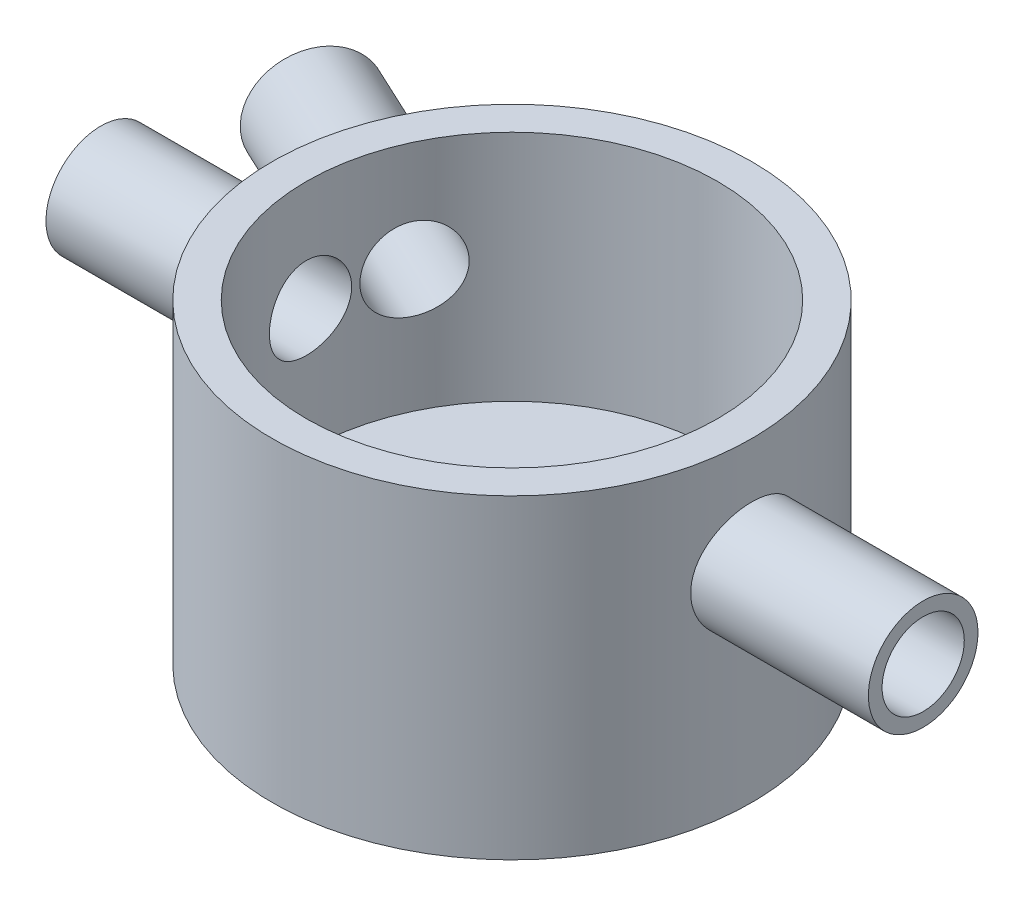
from build123d import *

# Parameters (mm, degrees)
FUROS_GUIA_COM_6_0MM1_D       = 6
FUROS_GUIA_COM_6_0MM2_REACH   = 46.246
FUROS_GUIA_COM_6_0MM2_BORE_R  = 3
RESSALTO_EXTRUS_O1_REACH      = 60.94
RESSALTO_EXTRUS_O1_END_RADIUS = 17.5
RESSALTO_EXTRUS_O1_START      = -30
ESBO_O4_R                     = 4
ESBO_O4_R_2                   = 3
RESSALTO_EXTRUS_O2_OUTLINE_W  = 1
RESSALTO_EXTRUS_O2_OUTLINE_H  = 12.963481803


# Read off the part's stored shape, not the designer's step: Ressalto-extrusão2
with BuildPart() as part:
    # Esboço1 → Revolução1 (revolve)
    with BuildSketch(Plane.XY, mode=Mode.PRIVATE) as revolu_o1_sk:
        Polygon((0, -15), (17.5, -15), (17.5, 8), (15, 8), (15, -9), (5, -9), (5, -11.5), (3.25, -11.5), (3.25, -12.5), (0, -12.5), align=None)
    revolve(revolu_o1_sk.sketch.rotate(Axis((0, 0, 0), (0, 1, 0)), 90), axis=Axis((0, 0, 0), (0, 1, 0)))

    # Furos-guia com Ø6.0mm1 (through all)
    with Locations(Plane(origin=(-17.5, 0, 0), x_dir=(0, 0, -1), z_dir=(-1, 0, 0))):
        with Locations((0, 0)):
            Hole(FUROS_GUIA_COM_6_0MM1_D / 2)

    # Furos-guia com Ø6.0mm2 bore (on position points) → Furos-guia com Ø6.0mm2 (cut, up to next)
    with BuildSketch(Plane(origin=(-15.860386273, 0, -7.39581958), x_dir=(0.422618261741, 0, -0.906307787037), z_dir=(-0.906307787037, 0, -0.422618261741)), mode=Mode.PRIVATE) as furos_guia_com_6_0mm2_sk1:
        Circle(FUROS_GUIA_COM_6_0MM2_BORE_R)
    furos_guia_com_6_0mm2_tool1 = extrude(furos_guia_com_6_0mm2_sk1.sketch, amount=-FUROS_GUIA_COM_6_0MM2_REACH, mode=Mode.PRIVATE) & part.part
    add(furos_guia_com_6_0mm2_tool1.solids().sort_by_distance((-15.860386, 0, -7.39582))[0], mode=Mode.SUBTRACT)

    # Ressalto-extrusão1: up to this cylinder (the profile starts outside it)
    ressalto_extrus_o1_end = Plane(origin=(0, 0, 0), z_dir=(0, -1, 0)) * Cylinder(RESSALTO_EXTRUS_O1_END_RADIUS, 157.88, mode=Mode.PRIVATE)
    # Esboço4 → Ressalto-extrusão1 (add, up to the surface)
    with BuildSketch(Plane(origin=(0, 0, 0), x_dir=(0, 0, -1), z_dir=(1, 0, 0)).offset(RESSALTO_EXTRUS_O1_START), mode=Mode.PRIVATE) as ressalto_extrus_o1_sk1:
        with Locations(Location((0, 0, 0), (0, 0, 180))):
            Circle(ESBO_O4_R)
        with Locations(Location((0, 0, 0), (0, 0, 180))):
            Circle(ESBO_O4_R_2, mode=Mode.SUBTRACT)
    ressalto_extrus_o1_tool1 = extrude(ressalto_extrus_o1_sk1.sketch, amount=RESSALTO_EXTRUS_O1_REACH, mode=Mode.PRIVATE) - ressalto_extrus_o1_end
    ressalto_extrus_o1 = ressalto_extrus_o1_tool1.solids().sort_by_distance((-30, 0, -3.886863))[0]
    add(ressalto_extrus_o1)

    # Espelhar3: Ressalto-extrusão1 across plane
    add(ressalto_extrus_o1.mirror(Plane(origin=(0, 0, 0), x_dir=(0, 0, 1), z_dir=(1, 0, 0))))

    # Ressalto-extrusão2 outline → Ressalto-extrusão2 (revolve)
    with BuildSketch(Plane(origin=(0, 0, 0), x_dir=(0, 1, 0), z_dir=(0.4226182617407003, 0, -0.9063077870366496))):
        with Locations((3.5, -23.518259099)):
            Rectangle(RESSALTO_EXTRUS_O2_OUTLINE_W, RESSALTO_EXTRUS_O2_OUTLINE_H)
    revolve(axis=Axis((0, 0, 0), (0.9063077870366496, 0, 0.4226182617407003)))


solid = part.part
